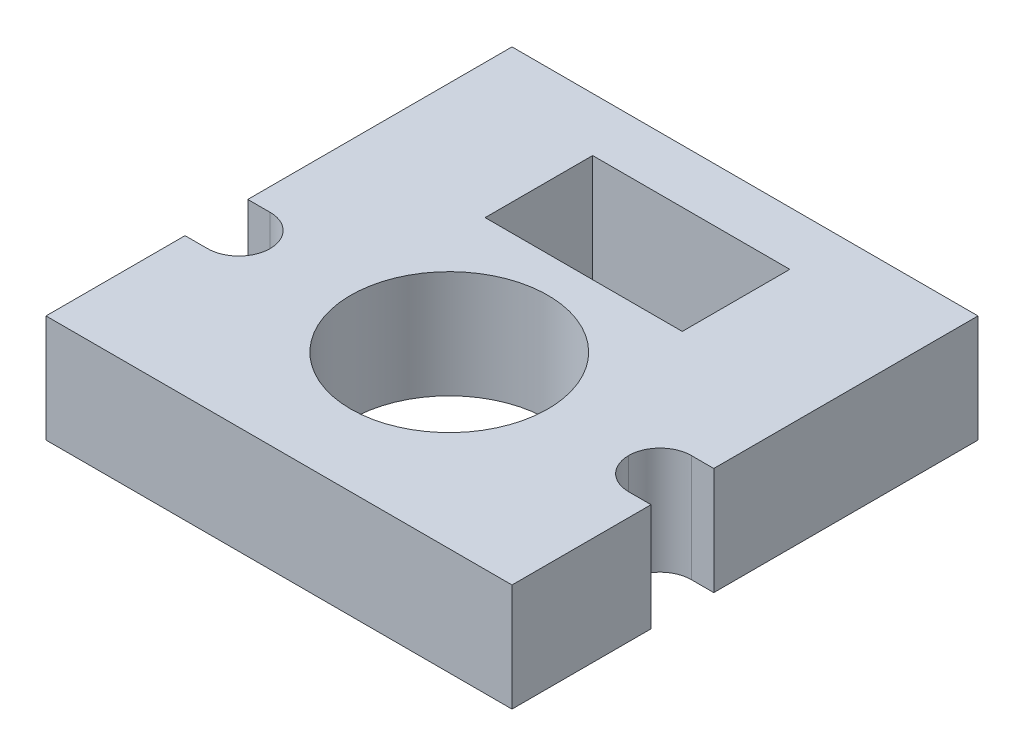
from build123d import *

# Parameters (mm, degrees)
ESBO_O1_R                = 5.5
RESSALTO_EXTRUS_O1_DEPTH = 6
FILETE1_R                = 1.75


with BuildPart() as part:
    # Esboço1 → Ressalto-extrusão1 (new body)
    with BuildSketch(Plane(origin=(0, 0, 0), x_dir=(1, 0, 0), z_dir=(0, 1, 0))):
        Polygon((-13, -13), (13, -13), (13, -5.242288745), (10, -5.242288745), (10, -1.742288745), (13, -1.742288745), (13, 13), (-13, 13), (-13, -1.742288745), (-10, -1.742288745), (-10, -5.242288745), (-13, -5.242288745), align=None)
        with Locations(Location((0, -3.5, 0), (0, 0, 270))):
            Circle(ESBO_O1_R, mode=Mode.SUBTRACT)
        Polygon((-5.5, 10), (0, 10), (5.5, 10), (5.5, 4), (-5.5, 4), align=None, mode=Mode.SUBTRACT)
    extrude(amount=RESSALTO_EXTRUS_O1_DEPTH)

    # Filete1
    filete1_edges = [part.edges().sort_by_distance(p)[0] for p in [
        (10, 3, 1.742288745),
        (10, 3, 5.242288745),
        (-10, 3, 1.742288745),
        (-10, 3, 5.242288745),
    ]]
    fillet(filete1_edges, radius=FILETE1_R - 0.0001)  # a hair under: the kernel refuses the full size


solid = part.part
